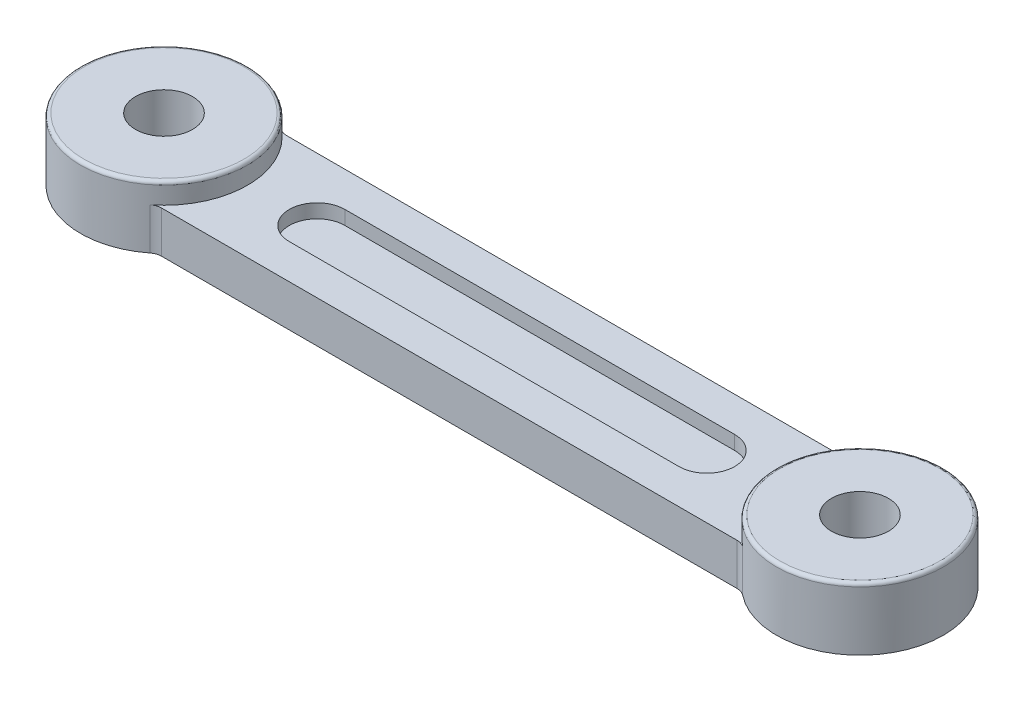
from build123d import *

# Parameters (mm, degrees)
EXTRUDE_1_DEPTH     = 6
SKETCH_2_R          = 12
EXTRUDE_2_DEPTH     = 3
SKETCH_3_R          = 4.1
CUT_EXTRUDE_1_DEPTH = 64.788713735
CUT_EXTRUDE_2_DEPTH = 2
FILLET_1_R          = 0.5
SKETCH_5_R          = 12
SKETCH_5_R_2        = 4.1
EXTRUDE_3_DEPTH     = 6
FILLET_2_R          = 2


with BuildPart() as part:
    # 草图1 → 凸台-拉伸1 (new body)
    with BuildSketch(Plane(origin=(0, 0, 0), x_dir=(1, 0, 0), z_dir=(0, 1, 0))):
        with BuildLine():
            Line((-50, 9), (50, 9))
            ThreePointArc((50, 9), (59, 0), (50, -9))
            Line((50, -9), (-50, -9))
            ThreePointArc((-50, -9), (-59, 0), (-50, 9))
        make_face()
    extrude(amount=EXTRUDE_1_DEPTH)

    # 草图2 → 凸台-拉伸2 (add)
    with BuildSketch(Plane(origin=(0, 6, 0), x_dir=(1, 0, 0), z_dir=(0, 1, 0))):
        with Locations((-50, 0)):
            Circle(SKETCH_2_R)
        with Locations((50, 0)):
            Circle(SKETCH_2_R)
    extrude(amount=EXTRUDE_2_DEPTH)

    # 草图3 → 切除-拉伸1 (cut, through all)
    with BuildSketch(Plane(origin=(0, 9, 0), x_dir=(1, 0, 0), z_dir=(0, 1, 0))):
        with Locations((-50, 0)):
            Circle(SKETCH_3_R)
        with Locations((50, 0)):
            Circle(SKETCH_3_R)
    extrude(amount=-CUT_EXTRUDE_1_DEPTH, mode=Mode.SUBTRACT)

    # 草图4 → 切除-拉伸2 (cut)
    with BuildSketch(Plane(origin=(0, 6, 0), x_dir=(1, 0, 0), z_dir=(0, 1, 0))):
        with BuildLine():
            Line((-28, 4), (28, 4))
            ThreePointArc((28, 4), (32, 0), (28, -4))
            Line((28, -4), (-28, -4))
            ThreePointArc((-28, -4), (-32, 0), (-28, 4))
        make_face()
    extrude(amount=-CUT_EXTRUDE_2_DEPTH, mode=Mode.SUBTRACT)

    # 圆角1
    fillet_1_edges = [part.edges().sort_by_distance(p)[0] for p in [
        (38, 9, 0),
        (-62, 9, 0),
    ]]
    fillet(fillet_1_edges, radius=FILLET_1_R)

    # 草图5 → 凸台-拉伸3 (add)
    # profile 1 of 2: a face of its own
    with BuildSketch(Plane.XZ):
        with Locations((-50, 0)):
            Circle(SKETCH_5_R)
        with Locations((-50, 0)):
            Circle(SKETCH_5_R_2, mode=Mode.SUBTRACT)
    # profile 2 of 2: a face of its own
    with BuildSketch(Plane.XZ):
        with Locations((50, 0)):
            Circle(SKETCH_5_R)
        with Locations((50, 0)):
            Circle(SKETCH_5_R_2, mode=Mode.SUBTRACT)
    extrude(amount=-EXTRUDE_3_DEPTH)

    # 圆角2
    fillet_2_edges = [part.edges().sort_by_distance(p)[0] for p in [
        (-42.062746067, 3, -9),
        (42.062746067, 3, -9),
        (42.062746067, 3, 9),
        (-42.062746067, 3, 9),
    ]]
    fillet(fillet_2_edges, radius=FILLET_2_R)


solid = part.part
